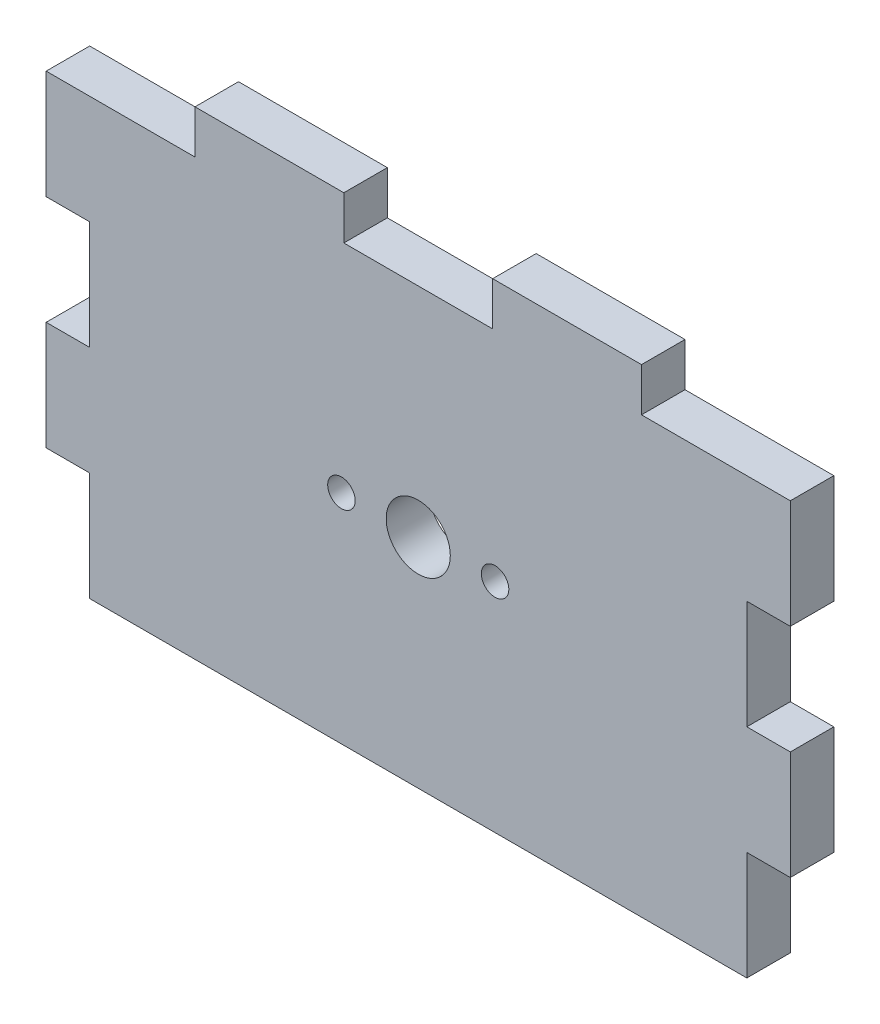
from build123d import *

# Parameters (mm, degrees)
SKETCH1_W                = 82.55
SKETCH1_H                = 53.086
BOSS_EXTRUDE1_DEPTH      = 4.826
CUT_EXTRUDE1_START       = -88.085249325
CUT_EXTRUDE1_OUTLINE_W   = 4.826
CUT_EXTRUDE1_OUTLINE_H   = 4.826
CUT_EXTRUDE1_DEPTH       = 16.51
CUT_EXTRUDE1_START_2     = -55.065249325
CUT_EXTRUDE1_2_OUTLINE_W = 4.826
CUT_EXTRUDE1_2_OUTLINE_H = 4.826
CUT_EXTRUDE1_2_DEPTH     = 16.51
CUT_EXTRUDE1_START_3     = -22.045249325
CUT_EXTRUDE1_3_OUTLINE_W = 4.826
CUT_EXTRUDE1_3_OUTLINE_H = 4.826
CUT_EXTRUDE1_3_DEPTH     = 16.51
SKETCH3_W                = 4.826
SKETCH3_H                = 12.065
CUT_EXTRUDE2_DEPTH       = 97.443575108
SKETCH4_R                = 3.556
SKETCH4_R_2              = 1.524
CUT_EXTRUDE3_DEPTH       = 97.443575108


# Read off the part's stored shape, not the designer's step: Cut-Extrude1
with BuildPart() as part:
    # Sketch1 → Boss-Extrude1 (new body)
    with BuildSketch(Plane.XY):
        with Locations((-46.810249325, -12.432142782)):
            Rectangle(SKETCH1_W, SKETCH1_H)
    extrude(amount=BOSS_EXTRUDE1_DEPTH)

    # Cut-Extrude1 outline → Cut-Extrude1 (cut)
    with BuildSketch(Plane.YZ.offset(CUT_EXTRUDE1_START)):
        with Locations((11.697857218, 2.413)):
            Rectangle(CUT_EXTRUDE1_OUTLINE_W, CUT_EXTRUDE1_OUTLINE_H)
    extrude(amount=CUT_EXTRUDE1_DEPTH, mode=Mode.SUBTRACT)

    # Cut-Extrude1 2 outline → Cut-Extrude1 2 (cut)
    with BuildSketch(Plane.YZ.offset(CUT_EXTRUDE1_START_2)):
        with Locations((11.697857218, 2.413)):
            Rectangle(CUT_EXTRUDE1_2_OUTLINE_W, CUT_EXTRUDE1_2_OUTLINE_H)
    extrude(amount=CUT_EXTRUDE1_2_DEPTH, mode=Mode.SUBTRACT)

    # Cut-Extrude1 3 outline → Cut-Extrude1 3 (cut)
    with BuildSketch(Plane.YZ.offset(CUT_EXTRUDE1_START_3)):
        with Locations((11.697857218, 2.413)):
            Rectangle(CUT_EXTRUDE1_3_OUTLINE_W, CUT_EXTRUDE1_3_OUTLINE_H)
    extrude(amount=CUT_EXTRUDE1_3_DEPTH, mode=Mode.SUBTRACT)

    # Sketch3 → Cut-Extrude2 (cut, through all)
    with BuildSketch(Plane.XY.offset(4.826)):
        with Locations((-85.672249325, -32.942642782)):
            Rectangle(SKETCH3_W, SKETCH3_H)
        with Locations((-85.672249325, -8.812642782)):
            Rectangle(SKETCH3_W, SKETCH3_H)
        with Locations((-7.948249325, -32.942642782)):
            Rectangle(SKETCH3_W, SKETCH3_H)
        with Locations((-7.948249325, -8.812642782)):
            Rectangle(SKETCH3_W, SKETCH3_H)
    extrude(amount=-CUT_EXTRUDE2_DEPTH, mode=Mode.SUBTRACT)

    # Sketch4 → Cut-Extrude3 (cut, through all)
    with BuildSketch(Plane.XY.offset(4.826)):
        with Locations((-46.810249325, -14.845142782)):
            Circle(SKETCH4_R)
        with Locations((-55.331949325, -14.845142782)):
            Circle(SKETCH4_R_2)
        with Locations(Location((-38.288549325, -14.845142782, 0), (0, 0, 180))):
            Circle(SKETCH4_R_2)
    extrude(amount=-CUT_EXTRUDE3_DEPTH, mode=Mode.SUBTRACT)


solid = part.part
